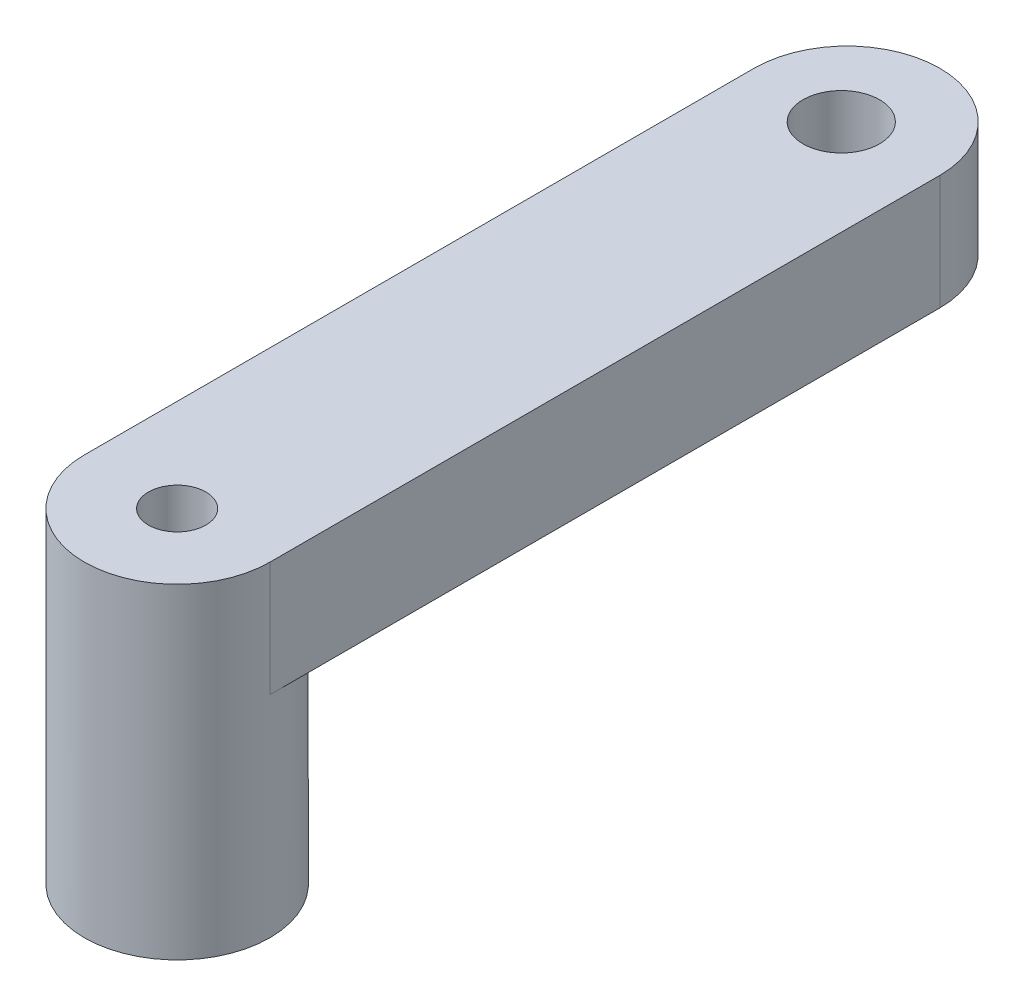
from build123d import *

# Parameters (mm, degrees)
SKETCH1_R           = 4.85
SKETCH1_R_2         = 1.5
BOSS_EXTRUDE1_DEPTH = 11
BOSS_EXTRUDE2_DEPTH = 6
SKETCH3_R           = 2
CUT_EXTRUDE1_DEPTH  = 7
SKETCH6_R           = 1.5
CUT_EXTRUDE2_DEPTH  = 10


with BuildPart() as part:
    # Sketch1 → Boss-Extrude1 (new body)
    with BuildSketch(Plane(origin=(0, 0, 0), x_dir=(1, 0, 0), z_dir=(0, 1, 0))):
        Circle(SKETCH1_R)
        Circle(SKETCH1_R_2, mode=Mode.SUBTRACT)
    extrude(amount=BOSS_EXTRUDE1_DEPTH)

    # Sketch2 → Boss-Extrude2 (add)
    with BuildSketch(Plane(origin=(0, 11, 0), x_dir=(1, 0, 0), z_dir=(0, 1, 0))):
        with BuildLine():
            Line((-4.85, 0), (-4.85, 35))
            ThreePointArc((-4.85, 35), (0, 39.85), (4.85, 35))
            Line((4.85, 35), (4.85, 0))
            ThreePointArc((4.85, 0), (0, -4.85), (-4.85, 0))
        make_face()
    extrude(amount=BOSS_EXTRUDE2_DEPTH)

    # Sketch3 → Cut-Extrude1 (cut)
    with BuildSketch(Plane(origin=(0, 17, 0), x_dir=(1, 0, 0), z_dir=(0, 1, 0))):
        with Locations((-0.15, 34.852250506)):
            Circle(SKETCH3_R)
    extrude(amount=-CUT_EXTRUDE1_DEPTH, mode=Mode.SUBTRACT)

    # Sketch6 → Cut-Extrude2 (cut)
    with BuildSketch(Plane.XZ.offset(-11)):
        Circle(SKETCH6_R)
    extrude(amount=-CUT_EXTRUDE2_DEPTH, mode=Mode.SUBTRACT)


solid = part.part
